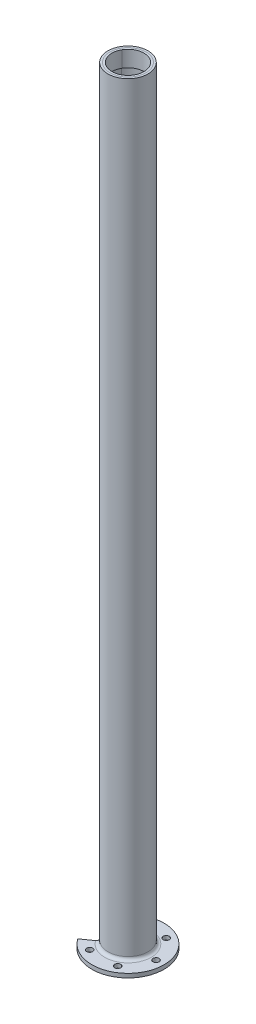
from build123d import *

# Parameters (mm, degrees)
SKETCH1_R               = 4.826
BOSS_EXTRUDE1_DEPTH     = 6.35
SKETCH2_R               = 31.75
SKETCH2_R_2             = 28.575
BOSS_EXTRUDE2_DEPTH     = 1209.802
BOSS_EXTRUDE3_START     = -25.4
SKETCH3_R               = 28.575
SKETCH3_R_2             = 25.4
BOSS_EXTRUDE3_DEPTH     = 25.4
CUT_EXTRUDE1_DEPTH      = 6.35
CUT_EXTRUDE1_DEPTH_BACK = 6.35
FILLET1_ANGLE           = 290


with BuildPart() as part:
    # Sketch1 → Boss-Extrude1 (new body)
    with BuildSketch(Plane(origin=(0, 0, 0), x_dir=(1, 0, 0), z_dir=(0, 1, 0))):
        with BuildLine():
            Line((-46.814539331, 32.779893337), (0, 0))
            Line((0, 0), (-46.814539331, -32.779893337))
            ThreePointArc((-46.814539331, -32.779893337), (57.15, 0), (-46.814539331, 32.779893337))
        make_face()
        with Locations(Location((44.45, 0, 0), (0, 0, 270))):
            Circle(SKETCH1_R, mode=Mode.SUBTRACT)
        with Locations(Location((22.225, -38.494829198, 0), (0, 0, 270))):
            Circle(SKETCH1_R, mode=Mode.SUBTRACT)
        with Locations(Location((-22.225, -38.494829198, 0), (0, 0, 270))):
            Circle(SKETCH1_R, mode=Mode.SUBTRACT)
        with Locations(Location((-22.225, 38.494829198, 0), (0, 0, 270))):
            Circle(SKETCH1_R, mode=Mode.SUBTRACT)
        with Locations(Location((22.225, 38.494829198, 0), (0, 0, 270))):
            Circle(SKETCH1_R, mode=Mode.SUBTRACT)
    extrude(amount=BOSS_EXTRUDE1_DEPTH)

    # Sketch2 → Boss-Extrude2 (add)
    with BuildSketch(Plane(origin=(0, 6.35, 0), x_dir=(1, 0, 0), z_dir=(0, 1, 0))):
        with Locations(Location((0, 0, 0), (0, 0, 145))):
            Circle(SKETCH2_R)
        with Locations(Location((0, 0, 0), (0, 0, 145))):
            Circle(SKETCH2_R_2, mode=Mode.SUBTRACT)
    extrude(amount=BOSS_EXTRUDE2_DEPTH)

    # Sketch3 → Boss-Extrude3 (add)
    with BuildSketch(Plane(origin=(0, 1216.152, 0), x_dir=(1, 0, 0), z_dir=(0, 1, 0)).offset(BOSS_EXTRUDE3_START)):
        with Locations(Location((0, 0, 0), (0, 0, 145))):
            Circle(SKETCH3_R)
        with Locations(Location((0, 0, 0), (0, 0, 270))):
            Circle(SKETCH3_R_2, mode=Mode.SUBTRACT)
    extrude(amount=BOSS_EXTRUDE3_DEPTH)

    # Sketch4 → Cut-Extrude1 (cut, two sides: drawn at the far end of the back side and taken through both)
    with BuildSketch(Plane(origin=(13.5255, 0, -23.426853198), x_dir=(-0.8660254037844382, 0, -0.5000000000000009), z_dir=(0.5000000000000009, 0, -0.8660254037844382)).offset(-CUT_EXTRUDE1_DEPTH_BACK)):
        with BuildLine():
            Line((4.7625, 1185.9895), (4.7625, 712.9145))
            ThreePointArc((4.7625, 712.9145), (0, 708.152), (-4.7625, 712.9145))
            Line((-4.7625, 712.9145), (-4.7625, 1185.9895))
            ThreePointArc((-4.7625, 1185.9895), (0, 1190.752), (4.7625, 1185.9895))
        make_face()
    extrude(amount=CUT_EXTRUDE1_DEPTH + CUT_EXTRUDE1_DEPTH_BACK, mode=Mode.SUBTRACT)

    # Fillet1: read off the stored shape, not the designer's step
    # Fillet1 outline → Fillet1 (revolve)
    with BuildSketch(Plane(origin=(0, 0, 0), x_dir=(-0.8191520442889906, 0, 0.5735764363510478), z_dir=(-0.5735764363510478, 0, -0.8191520442889906))):
        with BuildLine():
            ThreePointArc((36.83, 6.35), (33.237897552, 7.837897552), (31.75, 11.43))
            Line((31.75, 11.43), (31.75, 6.35))
            Line((31.75, 6.35), (36.83, 6.35))
        make_face()
    revolve(axis=Axis((0, 0, 0), (0, 1, 0)), revolution_arc=FILLET1_ANGLE)


solid = part.part
